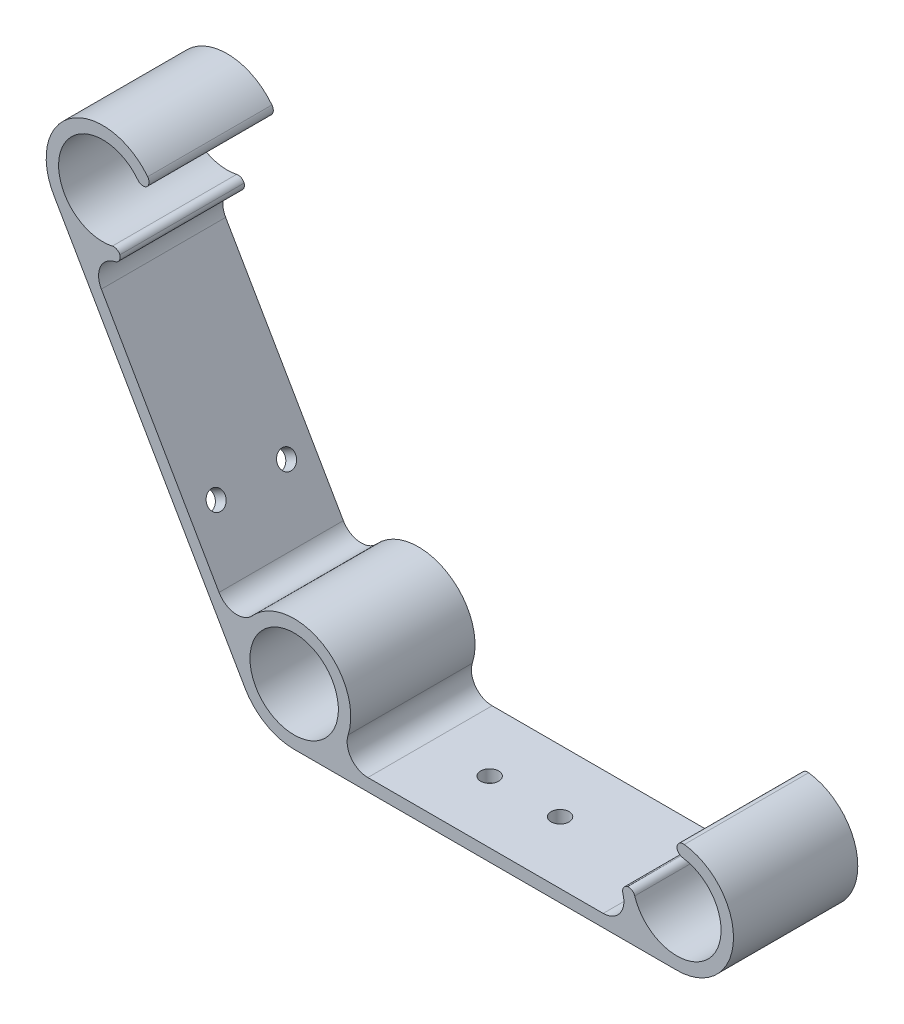
from build123d import *

# Parameters (mm, degrees)
SKETCH3_W               = 114.3
SKETCH3_H               = 38.1
BOSS_EXTRUDE1_DEPTH     = 3.81
BOSS_EXTRUDE2_START     = -19.05
BOSS_EXTRUDE2_OUTLINE_R = 13.5453125
BOSS_EXTRUDE2_DEPTH     = 38.1
FILLET1_R               = 2.032
SKETCH5_R               = 2.749999961
CUT_EXTRUDE4_DEPTH      = 12.7
SKETCH6_R               = 2.749999961
CUT_EXTRUDE5_DEPTH      = 7.62


# Read off the part's stored shape, not the designer's step: Boss-Extrude2
with BuildPart() as part:
    # Sketch3 → Boss-Extrude1 (new body)
    with BuildSketch(Plane(origin=(0, 0, 0), x_dir=(1, 0, 0), z_dir=(0, 1, 0))):
        Rectangle(SKETCH3_W, SKETCH3_H)
    extrude(amount=BOSS_EXTRUDE1_DEPTH)

    # Boss-Extrude2 outline → Boss-Extrude2 (add)
    # profile 1 of 2: a face of its own
    with BuildSketch(Plane.XY.offset(BOSS_EXTRUDE2_START)):
        with BuildLine():
            ThreePointArc((58.658787305, 0), (76.014099805, 17.3553125), (58.658787305, 34.710625))
            Line((58.658787305, 34.710625), (58.658787305, 30.900625))
            ThreePointArc((58.658787305, 30.900625), (69.035098676, 8.648553456), (45.319258538, 15.003193668))
            Line((45.319258538, 15.003193668), (41.567140999, 14.341594112))
            ThreePointArc((41.567140999, 14.341594112), (41.806974837, 13.2052175), (42.122274879, 12.087425946))
            ThreePointArc((42.122274879, 12.087425946), (41.198342199, 6.412778013), (36.071859255, 3.81))
            Line((36.071859255, 3.81), (57.15, 3.81))
            Line((57.15, 3.81), (57.15, 0))
            Line((57.15, 0), (58.658787305, 0))
        make_face()
    # profile 2 of 2: a face of its own
    with BuildSketch(Plane.XY.offset(BOSS_EXTRUDE2_START)):
        with BuildLine():
            Line((-58.658787305, 0), (-57.15, 0))
            Line((-57.15, 0), (-57.15, 3.81))
            Line((-57.15, 3.81), (-36.071859255, 3.81))
            ThreePointArc((-36.071859255, 3.81), (-41.198342199, 6.412778013), (-42.122274879, 12.087425946))
            ThreePointArc((-42.122274879, 12.087425946), (-49.981131055, 32.385454016), (-71.489167098, 29.042409074))
            ThreePointArc((-71.489167098, 29.042409074), (-76.865522705, 27.00523428), (-81.682836057, 30.143509735))
            Line((-81.682836057, 30.143509735), (-117.754695312, 92.621802688))
            ThreePointArc((-117.754695312, 92.621802688), (-118.063864905, 98.362856156), (-113.611441977, 102.000329294))
            ThreePointArc((-113.611441977, 102.000329294), (-112.485756074, 102.286167225), (-111.381708141, 102.646653335))
            Line((-111.381708141, 102.646653335), (-112.684804887, 106.22688222))
            ThreePointArc((-112.684804887, 106.22688222), (-130.046004812, 123.588082145), (-105.586989883, 125.727968673))
            Line((-105.586989883, 125.727968673), (-102.287433094, 127.632968673))
            ThreePointArc((-102.287433094, 127.632968673), (-125.99523086, 133.985453938), (-132.347716126, 110.277656173))
            Line((-132.347716126, 110.277656173), (-73.688928821, 8.67765625))
            ThreePointArc((-73.688928821, 8.67765625), (-67.336443555, 2.325170984), (-58.658787305, 0))
        make_face()
        with Locations((-58.658787305, 17.3553125)):
            Circle(BOSS_EXTRUDE2_OUTLINE_R, mode=Mode.SUBTRACT)
    extrude(amount=BOSS_EXTRUDE2_DEPTH)

    # Fillet1
    # the kernel refuses this fillet: 2.032 mm, written as the material it takes off along each edge
    with BuildSketch(Plane(origin=(58.658787305, 34.710625, -24.816396244), x_dir=(0.9977896842762429, -0.06645107938864002, 0), z_dir=(0, 0, 1))) as fillet1_piece_1:
        with BuildLine():
            CenterArc((2.171529904, -2.027508638), FILLET1_R, 86.189825964, 97.620348072)
            Line((0.144021266, -2.162537232), (0, 0))
            ThreePointArc((0, 0), (1.153279249, 0.03836072), (2.306558498, 0))
        make_face()
    extrude(amount=49.632792488, mode=Mode.SUBTRACT)
    with BuildSketch(Plane(origin=(58.658787305, 30.900625, -23.797245223), x_dir=(0, 1, 0), z_dir=(0, 0, 1)), Plane(origin=(-112.684804887, 106.22688222, -23.797245223), x_dir=(0.342020143325642, -0.9396926207859182, 0), z_dir=(0, 0, 1))) as fillet1_piece_2:
        with BuildLine():
            CenterArc((1.898898089, -2.032), FILLET1_R, 90, 82.504627273)
            ThreePointArc((-0.115739283, -1.766933481), (-0.028965791, -0.885360027), (0, 0))
            Line((0, 0), (1.898898089, 0))
        make_face()
    extrude(amount=47.594490446, mode=Mode.SUBTRACT)
    with BuildSketch(Plane(origin=(45.319258538, 15.003193668, -23.797245222), x_dir=(0.23764666879808158, -0.9713516669101747, 0), z_dir=(0, 0, 1))) as fillet1_piece_3:
        with BuildLine():
            CenterArc((1.903537334, -2.027654697), FILLET1_R, 93.747686362, 82.50462726)
            Line((-0.124117363, -1.894837416), (0, 0))
            ThreePointArc((0, 0), (0.885360027, -0.028965791), (1.770720053, 0))
        make_face()
    extrude(amount=47.594490443, mode=Mode.SUBTRACT)
    with BuildSketch(Plane(origin=(41.567140999, 14.341594112, -24.816396246), x_dir=(0.984807753053284, 0.17364817743397684, 0), z_dir=(0, 0, 1))) as fillet1_piece_4:
        with BuildLine():
            CenterArc((2.167327711, -2.032), FILLET1_R, 90, 97.620348093)
            ThreePointArc((0.153273303, -2.301460276), (0.038360721, -1.153279249), (0, 0))
            Line((0, 0), (2.167327711, 0))
        make_face()
    extrude(amount=49.632792491, mode=Mode.SUBTRACT)
    with BuildSketch(Plane(origin=(-102.287433094, 127.632968673, -24.816396244), x_dir=(-0.8660254038225857, -0.4999999999339274, 0), z_dir=(0, 0, 1))) as fillet1_piece_5:
        with BuildLine():
            CenterArc((2.167327711, -2.032), FILLET1_R, 90, 97.62034808)
            ThreePointArc((0.153273302, -2.301460275), (0.03836072, -1.153279249), (0, 0))
            Line((0, 0), (2.167327711, 0))
        make_face()
    extrude(amount=49.632792489, mode=Mode.SUBTRACT)
    with BuildSketch(Plane(origin=(-105.586989883, 125.727968673, -23.797245222), x_dir=(-0.5555366573888737, 0.8314920458412077, 0), z_dir=(0, 0, 1))) as fillet1_piece_6:
        with BuildLine():
            CenterArc((1.903537334, -2.027654697), FILLET1_R, 93.747686363, 82.504627266)
            Line((-0.124117363, -1.894837416), (0, 0))
            ThreePointArc((0, 0), (0.885360027, -0.028965791), (1.770720053, 0))
        make_face()
    extrude(amount=47.594490445, mode=Mode.SUBTRACT)
    with BuildSketch(Plane(origin=(-111.381708141, 102.646653335, -24.816396244), x_dir=(-0.960343211064482, -0.2788205820278691, 0), z_dir=(0, 0, 1))) as fillet1_piece_7:
        with BuildLine():
            CenterArc((2.171529904, -2.027508638), FILLET1_R, 86.189825951, 97.620348077)
            Line((0.144021265, -2.162537231), (0, 0))
            ThreePointArc((0, 0), (1.153279249, 0.03836072), (2.306558498, 0))
        make_face()
    extrude(amount=49.632792488, mode=Mode.SUBTRACT)

    # Sketch5 → Cut-Extrude4 (cut)
    with BuildSketch(Plane(origin=(0, 3.81, 0), x_dir=(1, 0, 0), z_dir=(0, 1, 0))):
        with Locations(Location((-17.78, 0, 0), (0, 0, 270))):
            Circle(SKETCH5_R)
        with Locations(Location((3.81, 0, 0), (0, 0, 270))):
            Circle(SKETCH5_R)
    extrude(amount=-CUT_EXTRUDE4_DEPTH, mode=Mode.SUBTRACT)

    # Sketch6 → Cut-Extrude5 (cut)
    with BuildSketch(Plane(origin=(-48.209604448, -27.833828106, 0), x_dir=(0, 0, -1), z_dir=(0.8660254037844433, 0.4999999999999923, 0))):
        with Locations(Location((-10.795, 85.238322473, 0), (0, 0, 90))):
            Circle(SKETCH6_R)
        with Locations(Location((10.795, 85.238322473, 0), (0, 0, 90))):
            Circle(SKETCH6_R)
    extrude(amount=-CUT_EXTRUDE5_DEPTH, mode=Mode.SUBTRACT)


solid = part.part
